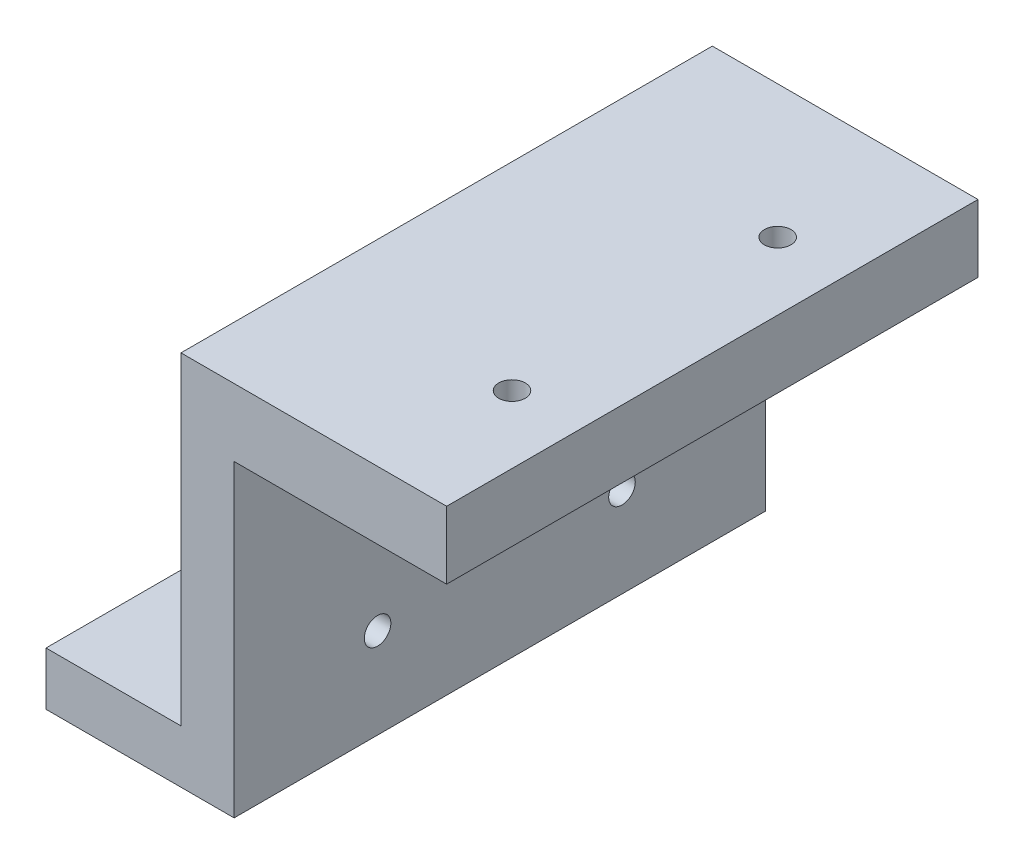
from build123d import *

# Parameters (mm, degrees)
SKETCH1_W             = 50
SKETCH1_H             = 12.7
BOSS_EXTRUDE1_DEPTH   = 100
SKETCH2_W             = 10
SKETCH2_H             = 100
BOSS_EXTRUDE2_DEPTH   = 58.1
SKETCH3_W             = 100
SKETCH3_H             = 10
BOSS_EXTRUDE3_DEPTH   = 25.4
M5X0_8_TAPPED_HOLE1_D = 5
M5X0_8_TAPPED_HOLE2_D = 5


with BuildPart() as part:
    # Sketch1 → Boss-Extrude1 (new body)
    with BuildSketch(Plane.XY):
        Rectangle(SKETCH1_W, SKETCH1_H)
    extrude(amount=BOSS_EXTRUDE1_DEPTH)

    # Sketch2 → Boss-Extrude2 (add)
    with BuildSketch(Plane.XZ.offset(6.35)):
        with Locations((-20, 50)):
            Rectangle(SKETCH2_W, SKETCH2_H)
    extrude(amount=BOSS_EXTRUDE2_DEPTH)

    # Sketch3 → Boss-Extrude3 (add)
    with BuildSketch(Plane.ZY.offset(25)):
        with Locations((50, -59.45)):
            Rectangle(SKETCH3_W, SKETCH3_H)
    extrude(amount=BOSS_EXTRUDE3_DEPTH)

    # M5x0.8 Tapped Hole1 (through all)
    with Locations(Plane(origin=(0, 6.35, 0), x_dir=(1, 0, 0), z_dir=(0, 1, 0))):
        with Locations((12.3, -75), (12.3, -25)):
            Hole(M5X0_8_TAPPED_HOLE1_D / 2)

    # M5x0.8 Tapped Hole2 (through all)
    with Locations(Plane(origin=(-15, 0, 0), x_dir=(0, 0, -1), z_dir=(1, 0, 0))):
        with Locations((-27, -29.45), (-73, -47.45), (-27, -47.45), (-73, -29.45)):
            Hole(M5X0_8_TAPPED_HOLE2_D / 2)


solid = part.part
